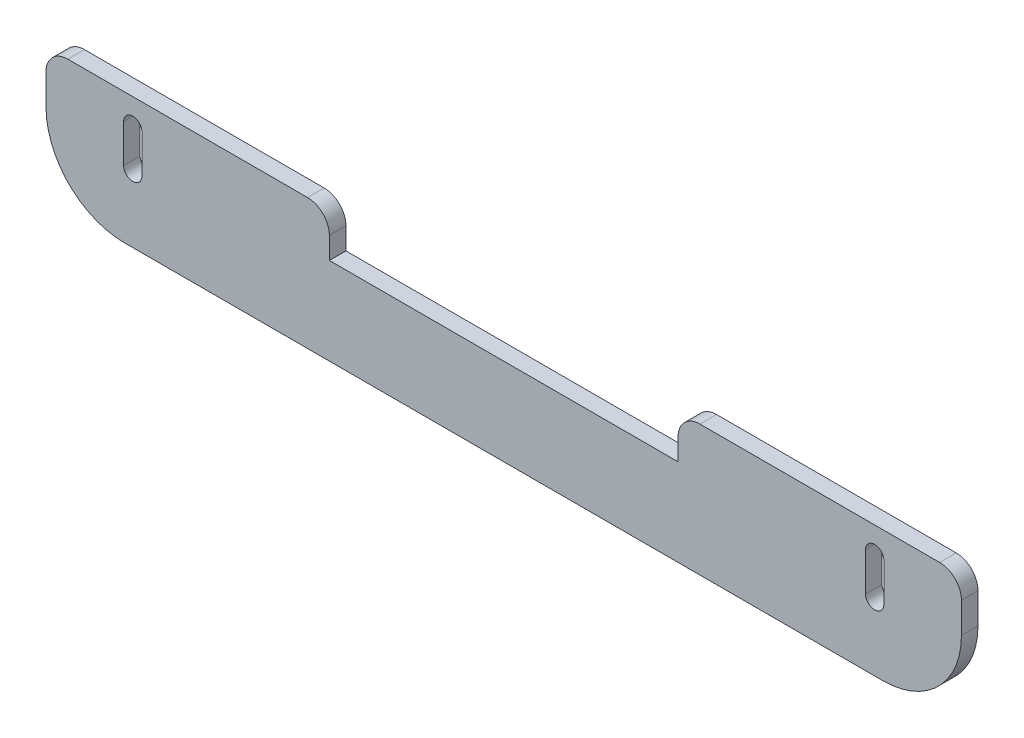
from build123d import *

# Parameters (mm, degrees)
BOSS_EXTRUDE1_DEPTH = 4.826
CUT_EXTRUDE1_DEPTH  = 270.450905131


with BuildPart() as part:
    # Sketch1 → Boss-Extrude1 (new body)
    with BuildSketch(Plane.XY):
        with BuildLine():
            Line((22.86, 0), (243.84, 0))
            ThreePointArc((243.84, 0), (260.004461018, 6.695538982), (266.7, 22.86))
            Line((266.7, 22.86), (266.7, 31.75))
            ThreePointArc((266.7, 31.75), (264.840128061, 36.240128061), (260.35, 38.1))
            Line((260.35, 38.1), (190.5, 38.1))
            ThreePointArc((190.5, 38.1), (186.009871939, 36.240128061), (184.15, 31.75))
            Line((184.15, 31.75), (184.15, 25.4))
            Line((184.15, 25.4), (82.55, 25.4))
            Line((82.55, 25.4), (82.55, 31.75))
            ThreePointArc((82.55, 31.75), (80.690128061, 36.240128061), (76.2, 38.1))
            Line((76.2, 38.1), (6.35, 38.1))
            ThreePointArc((6.35, 38.1), (1.859871939, 36.240128061), (0, 31.75))
            Line((0, 31.75), (0, 22.86))
            ThreePointArc((0, 22.86), (6.695538982, 6.695538982), (22.86, 0))
        make_face()
    extrude(amount=BOSS_EXTRUDE1_DEPTH)

    # Sketch2 → Cut-Extrude1 (cut, through all)
    with BuildSketch(Plane.XY.offset(4.826)):
        with BuildLine():
            Line((27.944557932, 30.523299942), (27.944557932, 19.353187014))
            ThreePointArc((27.944557932, 19.353187014), (25.278962802, 16.687591884), (22.613367672, 19.353187014))
            Line((22.613367672, 19.353187014), (22.613367672, 30.523299942))
            ThreePointArc((22.613367672, 30.523299942), (25.278962802, 33.188895072), (27.944557932, 30.523299942))
        make_face()
        with BuildLine():
            Line((238.755442068, 30.523299942), (238.755442068, 19.353187014))
            ThreePointArc((238.755442068, 19.353187014), (241.421037198, 16.687591884), (244.086632328, 19.353187014))
            Line((244.086632328, 19.353187014), (244.086632328, 30.523299942))
            ThreePointArc((244.086632328, 30.523299942), (241.421037198, 33.188895072), (238.755442068, 30.523299942))
        make_face()
    extrude(amount=-CUT_EXTRUDE1_DEPTH, mode=Mode.SUBTRACT)


solid = part.part
